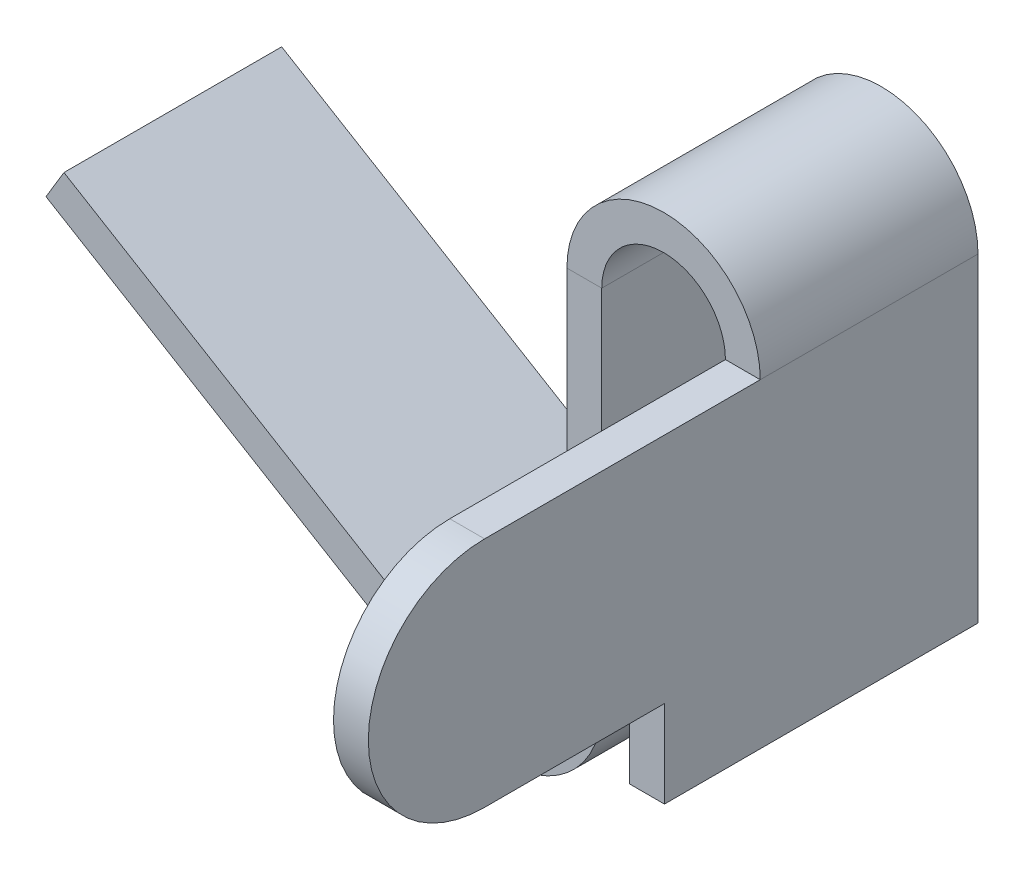
from build123d import *

# Parameters (mm, degrees)
BASE_FLANGE1_DEPTH  = 2.5
SKETCH3_W           = 0.4
SKETCH3_H           = 3.67
BOSS_EXTRUDE1_DEPTH = 4.5
SKETCH5_W           = 3.4
SKETCH5_H           = 1
CUT_EXTRUDE1_DEPTH  = 4.5
FILLET1_RADIUS      = 1.335
FILLET1_LENGTH      = 0.4


# Sheet-metal steps are written as plain solids
with BuildPart() as part:
    # Sketch2 → Base-Flange1 (new body)
    with BuildSketch(Plane.XY):
        with BuildLine():
            Line((0.71, -1.835), (0.71, 1.835))
            ThreePointArc((0.71, 1.835), (0, 2.545), (-0.71, 1.835))
            Line((-0.71, 1.835), (-0.71, -2.335))
            ThreePointArc((-0.71, -2.335), (-1.268334084, -3.292391266), (-2.376541882, -3.277884031))
            Line((-2.376541882, -3.277884031), (-7.090962036, -0.445174619))
            Line((-7.090962036, -0.445174619), (-6.884946806, -0.102307698))
            Line((-6.884946806, -0.102307698), (-2.170526652, -2.93501711))
            ThreePointArc((-2.170526652, -2.93501711), (-1.465303508, -2.944248987), (-1.11, -2.335))
            Line((-1.11, -2.335), (-1.11, 1.835))
            ThreePointArc((-1.11, 1.835), (0, 2.945), (1.11, 1.835))
            Line((1.11, 1.835), (1.11, -1.835))
            Line((1.11, -1.835), (0.71, -1.835))
        make_face()
    extrude(amount=BASE_FLANGE1_DEPTH)

    # Sketch3 → Boss-Extrude1 (add)
    with BuildSketch(Plane.XY.offset(2.5)):
        with Locations((0.91, 0)):
            Rectangle(SKETCH3_W, SKETCH3_H)
    extrude(amount=BOSS_EXTRUDE1_DEPTH)

    # Sketch5 → Cut-Extrude1 (cut)
    with BuildSketch(Plane(origin=(1.11, 0, 0), x_dir=(0, 0, -1), z_dir=(1, 0, 0))):
        with Locations((-5.3, -1.335)):
            Rectangle(SKETCH5_W, SKETCH5_H)
    extrude(amount=-CUT_EXTRUDE1_DEPTH, mode=Mode.SUBTRACT)

    # Fillet1: full round fillet: the end face becomes a half cylinder, R = half its width
    fillet1_face = Plane((0.91, 0.5, 7), x_dir=(-1, 0, 0), z_dir=(0, 0, 1))  # on the end face: x along it, z out of the body
    fillet1_slab = fillet1_face.offset(-FILLET1_RADIUS / 2) * Box(FILLET1_LENGTH, 2 * FILLET1_RADIUS, FILLET1_RADIUS, mode=Mode.PRIVATE)  # the body's end, R deep
    fillet1_round = Plane((0.91, 0.5, 5.665), x_dir=(0, 0, 1), z_dir=(-1, 0, 0)) * Cylinder(FILLET1_RADIUS, FILLET1_LENGTH, mode=Mode.PRIVATE)  # its axis R under the face
    add(fillet1_slab - fillet1_round, mode=Mode.SUBTRACT)


solid = part.part
